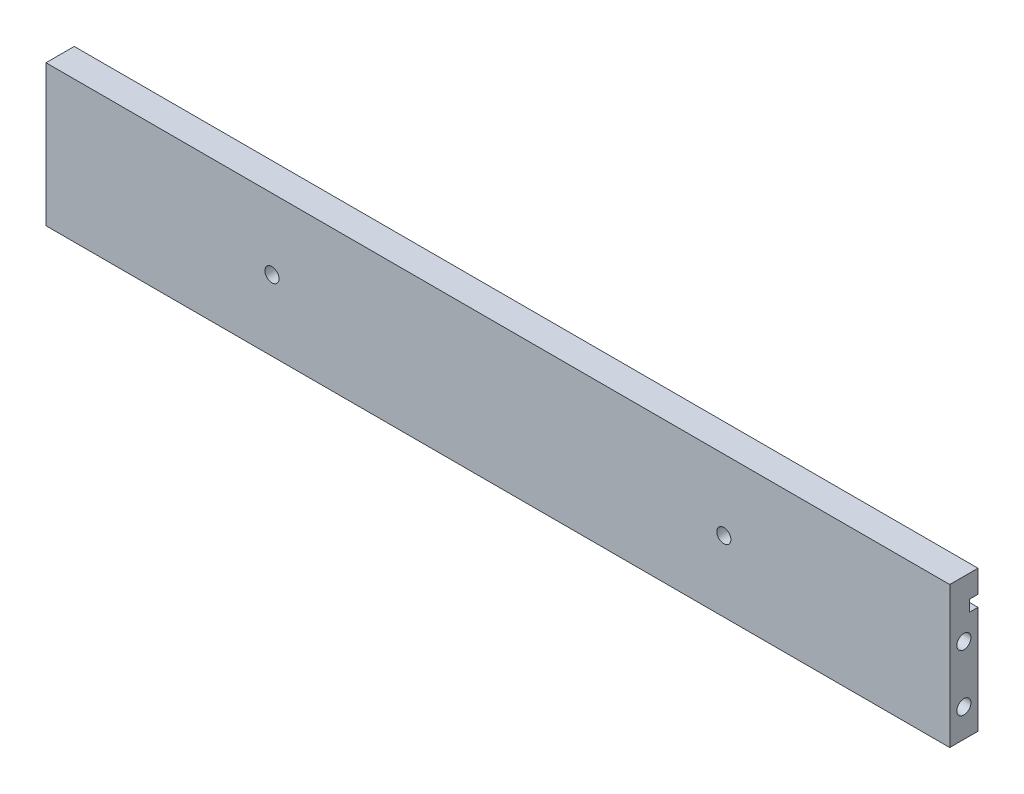
from build123d import *

# Parameters (mm, degrees)
SKETCH1_W           = 160
SKETCH1_H           = 25
BOSS_EXTRUDE1_DEPTH = 5
SKETCH2_R           = 1.25
SKETCH2_R_2         = 1.24
CUT_EXTRUDE1_DEPTH  = 10
SKETCH5_W           = 1.5
SKETCH5_H           = 2
CUT_EXTRUDE4_DEPTH  = 163.01851746
SKETCH6_R           = 1.25
CUT_EXTRUDE5_DEPTH  = 10
SKETCH7_R           = 1.25
CUT_EXTRUDE6_DEPTH  = 10
CUT_EXTRUDE7_START  = -10
SKETCH8_R           = 1.25
CUT_EXTRUDE7_DEPTH  = 10


with BuildPart() as part:
    # Sketch1 → Boss-Extrude1 (new body)
    with BuildSketch(Plane.XY):
        with Locations((80, 12.5)):
            Rectangle(SKETCH1_W, SKETCH1_H)
    extrude(amount=BOSS_EXTRUDE1_DEPTH)

    # Sketch2 → Cut-Extrude1 (cut)
    with BuildSketch(Plane.XZ):
        with Locations((40, 2.5)):
            Circle(SKETCH2_R)
        with Locations((120, 2.5)):
            Circle(SKETCH2_R_2)
    extrude(amount=-CUT_EXTRUDE1_DEPTH, mode=Mode.SUBTRACT)

    # Sketch5 → Cut-Extrude4 (cut, through all)
    with BuildSketch(Plane.ZY):
        with Locations((0.75, 20)):
            Rectangle(SKETCH5_W, SKETCH5_H)
    extrude(amount=-CUT_EXTRUDE4_DEPTH, mode=Mode.SUBTRACT)

    # Sketch6 → Cut-Extrude5 (cut)
    with BuildSketch(Plane.XY.offset(5)):
        with Locations((40, 12.5)):
            Circle(SKETCH6_R)
        with Locations((120, 12.5)):
            Circle(SKETCH6_R)
    extrude(amount=-CUT_EXTRUDE5_DEPTH, mode=Mode.SUBTRACT)

    # Sketch7 → Cut-Extrude6 (cut)
    with BuildSketch(Plane.ZY):
        with Locations((2.5, 5)):
            Circle(SKETCH7_R)
        with Locations((2.5, 15)):
            Circle(SKETCH7_R)
    extrude(amount=-CUT_EXTRUDE6_DEPTH, mode=Mode.SUBTRACT)

    # Sketch8 → Cut-Extrude7 (cut)
    with BuildSketch(Plane(origin=(160, 0, 0), x_dir=(0, 0, -1), z_dir=(1, 0, 0)).offset(CUT_EXTRUDE7_START)):
        with Locations((-2.5, 5)):
            Circle(SKETCH8_R)
        with Locations((-2.5, 15)):
            Circle(SKETCH8_R)
    extrude(amount=CUT_EXTRUDE7_DEPTH, mode=Mode.SUBTRACT)


solid = part.part
